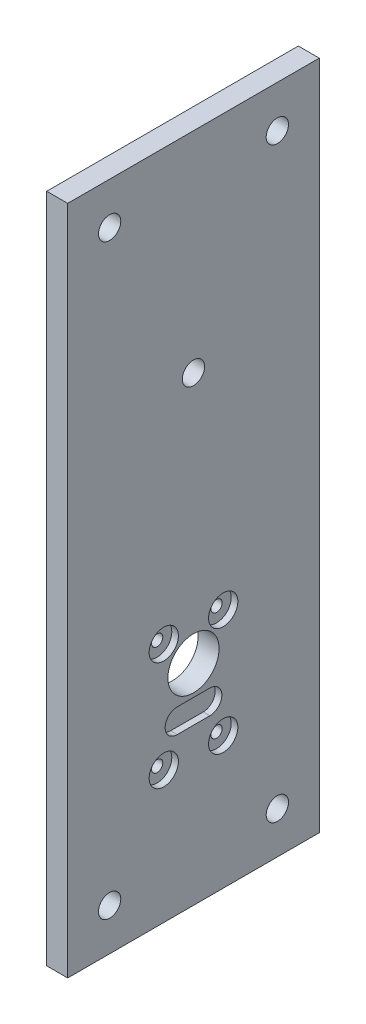
from build123d import *

# Parameters (mm, degrees)
SKETCH1_W               = 76.2
SKETCH1_H               = 203.2
SKETCH1_R               = 7.749999994
BOSS_EXTRUDE1_DEPTH     = 6.35
SKETCH7_R               = 7.235
SKETCH7_R_2             = 4.435
CUT_EXTRUDE2_DEPTH      = 2.000000064
M3_CLEARANCE_HOLE2_D    = 3.4
F_1_4_CLEARANCE_HOLE1_D = 6.7564


with BuildPart() as part:
    # Sketch1 → Boss-Extrude1 (new body)
    with BuildSketch(Plane(origin=(0, 0, 0), x_dir=(0, 0, -1), z_dir=(1, 0, 0))):
        with Locations((-7.597322741, 68.080830498)):
            Rectangle(SKETCH1_W, SKETCH1_H)
        with Locations((-7.597322741, 29.980830498)):
            Circle(SKETCH1_R, mode=Mode.SUBTRACT)
    extrude(amount=BOSS_EXTRUDE1_DEPTH)

    # Sketch7 → Cut-Extrude2 (cut)
    with BuildSketch(Plane(origin=(6.35, 0, 0), x_dir=(0, 0, -1), z_dir=(1, 0, 0))):
        with Locations((-7.597322741, 29.980830498)):
            Circle(SKETCH7_R)
        with Locations((1.402677259, 39.520209973)):
            Circle(SKETCH7_R_2)
        with Locations((-16.597322741, 39.520209973)):
            Circle(SKETCH7_R_2)
        with Locations((1.402677259, 6.520209973)):
            Circle(SKETCH7_R_2)
        with Locations((-16.597322741, 6.520209973)):
            Circle(SKETCH7_R_2)
        with BuildLine():
            Line((-12.547322741, 21.015830498), (-2.647322741, 21.015830498))
            ThreePointArc((-2.647322741, 21.015830498), (0.987677259, 17.380830498), (-2.647322741, 13.745830498))
            Line((-2.647322741, 13.745830498), (-12.547322741, 13.745830498))
            ThreePointArc((-12.547322741, 13.745830498), (-16.182322741, 17.380830498), (-12.547322741, 21.015830498))
        make_face()
    extrude(amount=-CUT_EXTRUDE2_DEPTH, mode=Mode.SUBTRACT)

    # M3 Clearance Hole2 (through all)
    with Locations(Plane(origin=(6.35, 0, 0), x_dir=(0, 0, -1), z_dir=(1, 0, 0))):
        with Locations((1.402677259, 6.520209973), (-16.597322741, 6.520209973), (-16.597322741, 39.520209973), (1.402677259, 39.520209973)):
            Hole(M3_CLEARANCE_HOLE2_D / 2)

    # 1/4 Clearance Hole1 (through all)
    with Locations(Plane(origin=(6.35, 0, 0), x_dir=(0, 0, -1), z_dir=(1, 0, 0))):
        with Locations((-32.997322741, -20.819169502), (17.802677259, -20.819169502), (-7.597322741, 106.180830498), (-32.997322741, 156.980830498), (17.802677259, 156.980830498)):
            Hole(F_1_4_CLEARANCE_HOLE1_D / 2)


solid = part.part
